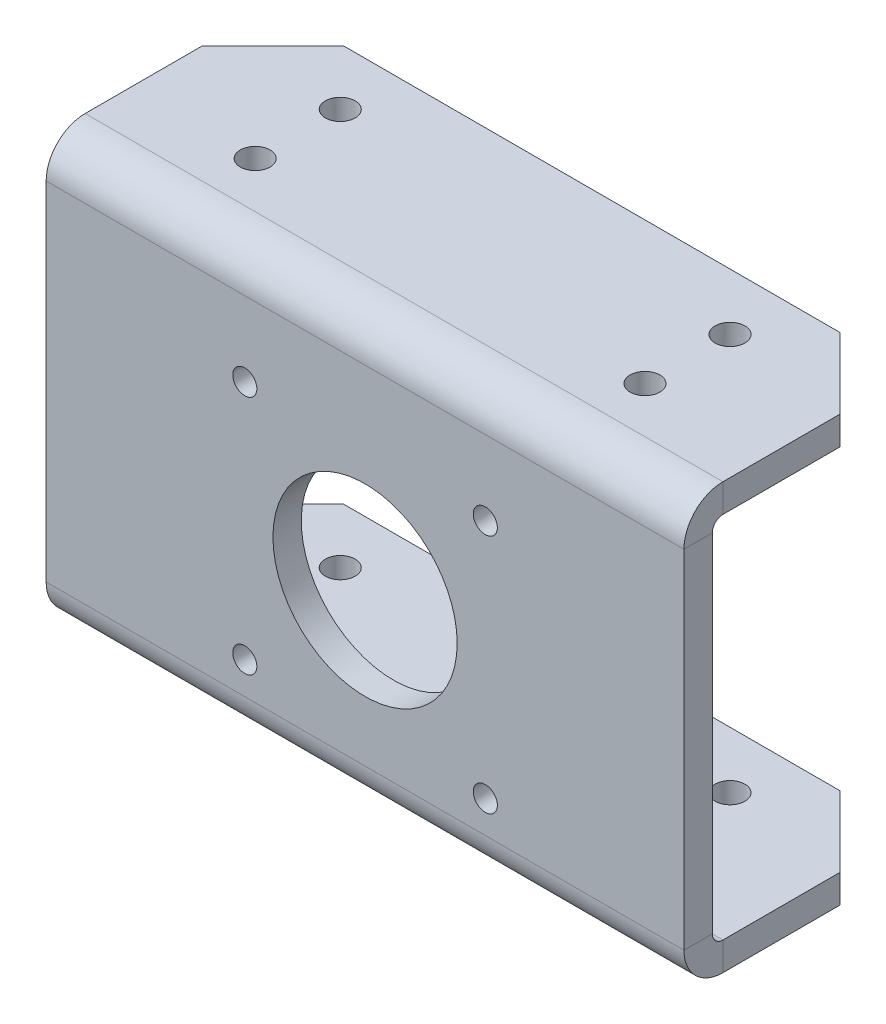
from build123d import *

# Parameters (mm, degrees)
SM_BASE_FLANGE_1_DEPTH   = 45
SKETCH_7_R               = 13
CUT_EXTRUDE_1_DEPTH      = 63.841069373
CHAMFER_1_SIZE           = 10
SKETCH_9_R               = 1
CUT_EXTRUDE_3_DEPTH      = 82.541400528
M5X0_8_1_D               = 4.2
CUT_EXTRUDE_4_REACH      = 64.841
SKETCH_11_R              = 1.7
PATTERN_CIRCULAR_1_COUNT = 4


# Sheet-metal steps are written as plain solids
with BuildPart() as part:
    # Sketch 2 → 基材-凸緣1 (new, symmetric)
    with BuildSketch(Plane(origin=(0, 0, 0), x_dir=(0, 0, -1), z_dir=(1, 0, 0))):
        with BuildLine():
            Line((32, -30), (5.5, -30))
            ThreePointArc((5.5, -30), (1.610912703, -28.389087297), (0, -24.5))
            Line((0, -24.5), (0, 24.5))
            ThreePointArc((0, 24.5), (1.610912703, 28.389087297), (5.5, 30))
            Line((5.5, 30), (32, 30))
            Line((32, 30), (32, 26))
            Line((32, 26), (5.5, 26))
            ThreePointArc((5.5, 26), (4.439339828, 25.560660172), (4, 24.5))
            Line((4, 24.5), (4, -24.5))
            ThreePointArc((4, -24.5), (4.439339828, -25.560660172), (5.5, -26))
            Line((5.5, -26), (32, -26))
            Line((32, -26), (32, -30))
        make_face()
    extrude(amount=SM_BASE_FLANGE_1_DEPTH, both=True)

    # 草圖7 → 除料-伸長1 (cut, through all)
    with BuildSketch(Plane.XY):
        with Locations((0, -3)):
            Circle(SKETCH_7_R)
    extrude(amount=-CUT_EXTRUDE_1_DEPTH, mode=Mode.SUBTRACT)

    # 導角1
    chamfer_1_edges = [part.edges().sort_by_distance(p)[0] for p in [
        (-45, 28, -32),
        (-45, -28, -32),
        (45, 28, -32),
        (45, -28, -32),
    ]]
    chamfer(chamfer_1_edges, length=CHAMFER_1_SIZE)

    # 草圖9 → 除料-伸長3 (cut, through all)
    with BuildSketch(Plane(origin=(0, 30, 0), x_dir=(1, 0, 0), z_dir=(0, 1, 0))):
        with Locations(Location((-27.5, 24, 0), (0, 0, 270))):
            Circle(SKETCH_9_R)
        with Locations(Location((27.5, 24, 0), (0, 0, 270))):
            Circle(SKETCH_9_R)
        with Locations(Location((-27.5, 12, 0), (0, 0, 270))):
            Circle(SKETCH_9_R)
        with Locations(Location((27.5, 12, 0), (0, 0, 270))):
            Circle(SKETCH_9_R)
    extrude(amount=-CUT_EXTRUDE_3_DEPTH, mode=Mode.SUBTRACT)

    # M5x0.8 螺紋孔1 (through all)
    with Locations(Plane(origin=(-27.5, 30, -24), x_dir=(0, 0, 1), z_dir=(0, 1, 0))):
        with Locations((0, 0), (12, 0), (12, 55), (0, 55)):
            Hole(M5X0_8_1_D / 2)

    # 草圖11 → 除料-伸長4 (cut, up to next)
    with BuildSketch(Plane.XY, mode=Mode.PRIVATE) as cut_extrude_4_sk1:
        with Locations((-16.970562748, 13.970562748)):
            Circle(SKETCH_11_R)
    cut_extrude_4_tool1 = extrude(cut_extrude_4_sk1.sketch, amount=-CUT_EXTRUDE_4_REACH, mode=Mode.PRIVATE) & part.part
    cut_extrude_4 = cut_extrude_4_tool1.solids().sort_by_distance((-16.970563, 13.970563, 0))[0]
    add(cut_extrude_4, mode=Mode.SUBTRACT)

    # 環狀複製排列1: 除料-伸長4 ×4 about axis
    pattern_circular_1_axis = Axis((0, -3, 0), (0, 0, 1))
    for i in range(1, PATTERN_CIRCULAR_1_COUNT):
        add(cut_extrude_4.rotate(pattern_circular_1_axis, i * 360 / PATTERN_CIRCULAR_1_COUNT), mode=Mode.SUBTRACT)


solid = part.part
